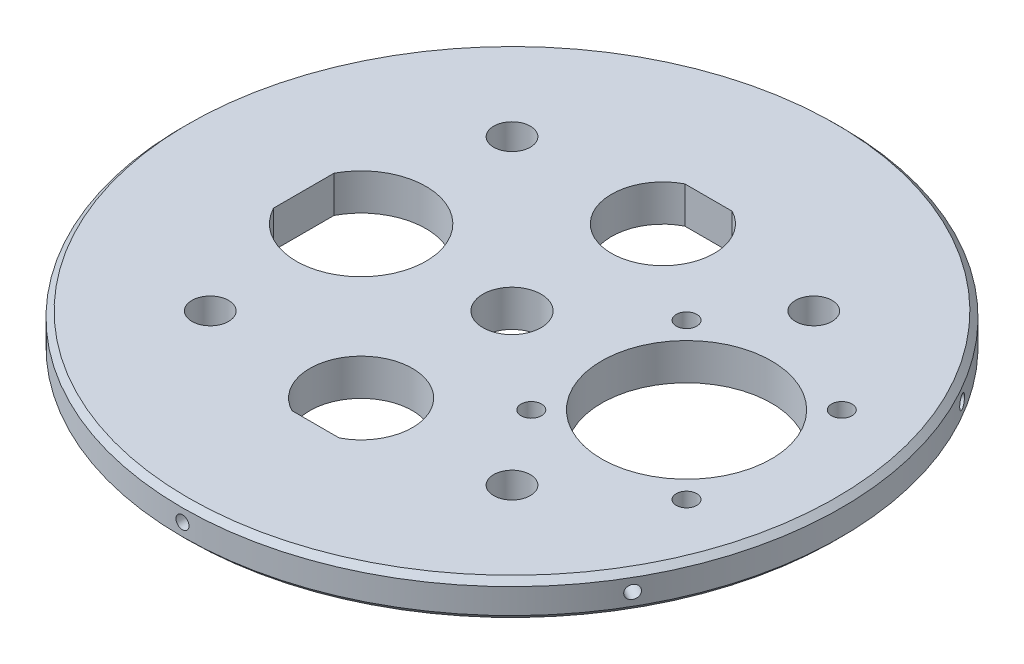
from build123d import *

# Parameters (mm, degrees)
SKETCH2_R           = 57.15
BOSS_EXTRUDE1_DEPTH = 6.35
CUT_EXTRUDE1_REACH  = 83.071
SKETCH6_R           = 3.175
SKETCH7_R           = 14.732
SKETCH7_R_2         = 1.778
CUT_EXTRUDE2_DEPTH  = 82.071372876
SKETCH8_R           = 5.042
CUT_EXTRUDE3_DEPTH  = 82.071372876
CIRPATTERN1_COUNT   = 6
CHAMFER1_SIZE       = 1


with BuildPart() as part:
    # Sketch2 → Boss-Extrude1 (new body)
    with BuildSketch(Plane(origin=(0, 0, 0), x_dir=(1, 0, 0), z_dir=(0, 1, 0))):
        Circle(SKETCH2_R)
    extrude(amount=BOSS_EXTRUDE1_DEPTH)

    # Sketch6 → Cut-Extrude1 (cut, up to next)
    with BuildSketch(Plane(origin=(0, 6.35, 0), x_dir=(1, 0, 0), z_dir=(0, 1, 0)), mode=Mode.PRIVATE) as cut_extrude1_sk1:
        with Locations((-26.1629, -26.1629)):
            Circle(SKETCH6_R)
    cut_extrude1_tool1 = extrude(cut_extrude1_sk1.sketch, amount=-CUT_EXTRUDE1_REACH, mode=Mode.PRIVATE) & part.part
    # Sketch6 → Cut-Extrude1 (cut, up to next)
    with BuildSketch(Plane(origin=(0, 6.35, 0), x_dir=(1, 0, 0), z_dir=(0, 1, 0)), mode=Mode.PRIVATE) as cut_extrude1_sk2:
        with Locations((26.1629, -26.1629)):
            Circle(SKETCH6_R)
    cut_extrude1_tool2 = extrude(cut_extrude1_sk2.sketch, amount=-CUT_EXTRUDE1_REACH, mode=Mode.PRIVATE) & part.part
    # Sketch6 → Cut-Extrude1 (cut, up to next)
    with BuildSketch(Plane(origin=(0, 6.35, 0), x_dir=(1, 0, 0), z_dir=(0, 1, 0)), mode=Mode.PRIVATE) as cut_extrude1_sk3:
        with Locations((-26.1629, 26.163103615)):
            Circle(SKETCH6_R)
    cut_extrude1_tool3 = extrude(cut_extrude1_sk3.sketch, amount=-CUT_EXTRUDE1_REACH, mode=Mode.PRIVATE) & part.part
    # Sketch6 → Cut-Extrude1 (cut, up to next)
    with BuildSketch(Plane(origin=(0, 6.35, 0), x_dir=(1, 0, 0), z_dir=(0, 1, 0)), mode=Mode.PRIVATE) as cut_extrude1_sk4:
        with Locations((26.1629, 26.163103615)):
            Circle(SKETCH6_R)
    cut_extrude1_tool4 = extrude(cut_extrude1_sk4.sketch, amount=-CUT_EXTRUDE1_REACH, mode=Mode.PRIVATE) & part.part
    add(cut_extrude1_tool1.solids().sort_by_distance((-26.1629, 6.35, 26.1629))[0], mode=Mode.SUBTRACT)
    add(cut_extrude1_tool2.solids().sort_by_distance((26.1629, 6.35, 26.1629))[0], mode=Mode.SUBTRACT)
    add(cut_extrude1_tool3.solids().sort_by_distance((-26.1629, 6.35, -26.163104))[0], mode=Mode.SUBTRACT)
    add(cut_extrude1_tool4.solids().sort_by_distance((26.1629, 6.35, -26.163104))[0], mode=Mode.SUBTRACT)

    # Sketch7 → Cut-Extrude2 (cut, through all)
    with BuildSketch(Plane(origin=(0, 6.35, 0), x_dir=(1, 0, 0), z_dir=(0, 1, 0))):
        with Locations((30, 0.269903496)):
            Circle(SKETCH7_R)
        with Locations((16.54, -13.194096504)):
            Circle(SKETCH7_R_2)
        with Locations((16.54, 13.729903496)):
            Circle(SKETCH7_R_2)
        with Locations((43.46, 13.729903496)):
            Circle(SKETCH7_R_2)
        with Locations((43.46, -13.194096504)):
            Circle(SKETCH7_R_2)
    extrude(amount=-CUT_EXTRUDE2_DEPTH, mode=Mode.SUBTRACT)

    # Sketch8 → Cut-Extrude3 (cut, through all)
    with BuildSketch(Plane(origin=(0, 6.35, 0), x_dir=(1, 0, 0), z_dir=(0, 1, 0))):
        Circle(SKETCH8_R)
        with BuildLine():
            Line((4.098780306, 34.063103615), (-4.098780306, 34.063103615))
            ThreePointArc((-4.098780306, 34.063103615), (0, 17.263103615), (4.098780306, 34.063103615))
        make_face()
        with BuildLine():
            Line((4.098780306, -34.0629), (-4.098780306, -34.0629))
            ThreePointArc((-4.098780306, -34.0629), (0, -17.2629), (4.098780306, -34.0629))
        make_face()
        with BuildLine():
            Line((-36.1129, 5.249761899), (-36.1129, -5.249761899))
            ThreePointArc((-36.1129, -5.249761899), (-14.9129, 0), (-36.1129, 5.249761899))
        make_face()
    extrude(amount=-CUT_EXTRUDE3_DEPTH, mode=Mode.SUBTRACT)

    # Sketch16 → #4-40 Tapped Hole2 (revolve, cut)
    with BuildSketch(Plane(origin=(0, 3.175, -57.15), x_dir=(0, 1, 0), z_dir=(1, 0, 0))):
        Polygon((0, 0), (0, 10.679152758), (1.1303, 10), (1.1303, 0), align=None)
    f_4_40_tapped_hole2 = revolve(axis=Axis((0, 3.175, -63.5), (0, 0, 1)), mode=Mode.SUBTRACT)

    # CirPattern1: #4-40 Tapped Hole2 ×6 about axis
    cirpattern1_axis = Axis((0, 0, 0), (0, 1, 0))
    for i in range(1, CIRPATTERN1_COUNT):
        add(f_4_40_tapped_hole2.rotate(cirpattern1_axis, i * 360 / CIRPATTERN1_COUNT), mode=Mode.SUBTRACT)

    # Chamfer1
    chamfer1_edges = [part.edges().sort_by_distance(p)[0] for p in [
        (-57.15, 6.35, 0),
        (-57.15, 0, 0),
    ]]
    chamfer(chamfer1_edges, length=CHAMFER1_SIZE)


solid = part.part
